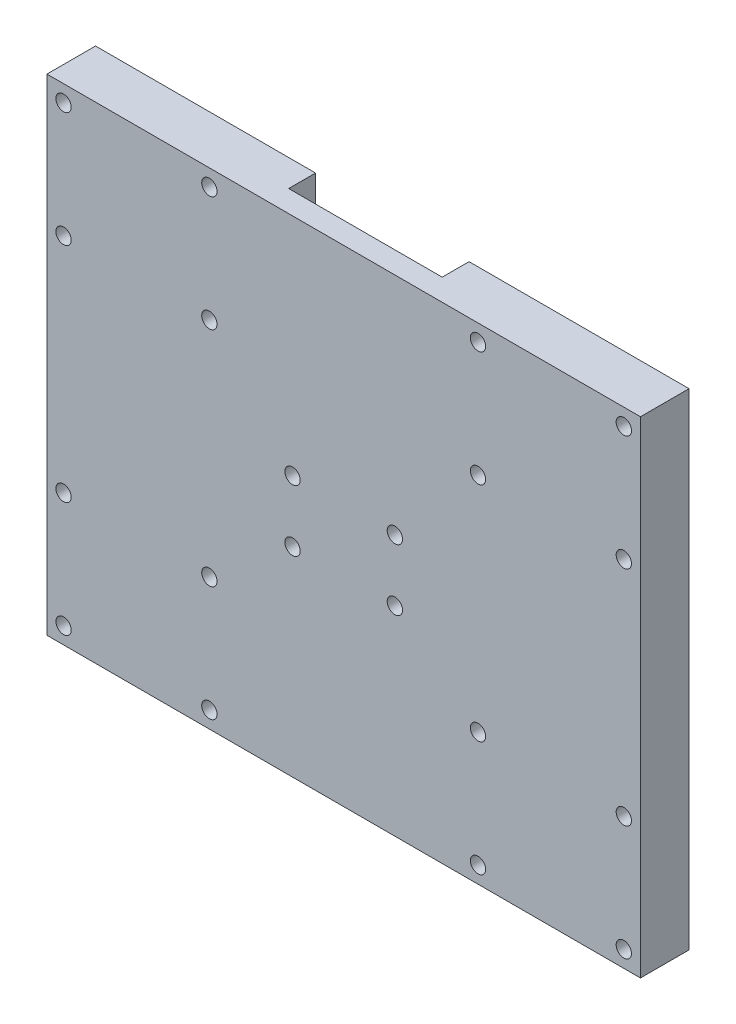
from build123d import *

# Parameters (mm, degrees)
SCHIZZO1_W                   = 232
SCHIZZO1_H                   = 190
ESTRUSIONE_ESTRUSIONE1_DEPTH = 19
SCHIZZO3_R                   = 3
TAGLIO_ESTRUSIONE1_DEPTH     = 152.135700614
SCHIZZO4_W                   = 60
SCHIZZO4_H                   = 10.5
TAGLIO_ESTRUSIONE2_DEPTH     = 224.421127022


with BuildPart() as part:
    # Schizzo1 → Estrusione-Estrusione1 (new body)
    with BuildSketch(Plane.XY):
        Rectangle(SCHIZZO1_W, SCHIZZO1_H)
    extrude(amount=ESTRUSIONE_ESTRUSIONE1_DEPTH)

    # Schizzo3 → Taglio-Estrusione1 (cut, through all)
    with BuildSketch(Plane.XY.offset(19)):
        with Locations((20, 7)):
            Circle(SCHIZZO3_R)
        with Locations((-20, 7)):
            Circle(SCHIZZO3_R)
        with Locations((-20, -17)):
            Circle(SCHIZZO3_R)
        with Locations((20, -17)):
            Circle(SCHIZZO3_R)
        with Locations((-109.5, 88.5)):
            Circle(SCHIZZO3_R)
        with Locations((-52.5, 88.5)):
            Circle(SCHIZZO3_R)
        with Locations((-109.5, 43.5)):
            Circle(SCHIZZO3_R)
        with Locations((-52.5, 43.5)):
            Circle(SCHIZZO3_R)
        with Locations((-109.5, -88.5)):
            Circle(SCHIZZO3_R)
        with Locations((-109.5, -43.5)):
            Circle(SCHIZZO3_R)
        with Locations((-52.5, -88.5)):
            Circle(SCHIZZO3_R)
        with Locations((-52.5, -43.5)):
            Circle(SCHIZZO3_R)
    taglio_estrusione1 = extrude(amount=-TAGLIO_ESTRUSIONE1_DEPTH, mode=Mode.SUBTRACT)

    # Schizzo4 → Taglio-Estrusione2 (cut, through all)
    with BuildSketch(Plane(origin=(0, 95, 0), x_dir=(1, 0, 0), z_dir=(0, 1, 0))):
        with Locations((0, -5.25)):
            Rectangle(SCHIZZO4_W, SCHIZZO4_H)
    extrude(amount=-TAGLIO_ESTRUSIONE2_DEPTH, mode=Mode.SUBTRACT)

    # Specchia1: Taglio-Estrusione1 across plane
    add(taglio_estrusione1.mirror(Plane(origin=(0, 0, 0), x_dir=(0, 0, 1), z_dir=(1, 0, 0))), mode=Mode.SUBTRACT)


solid = part.part
